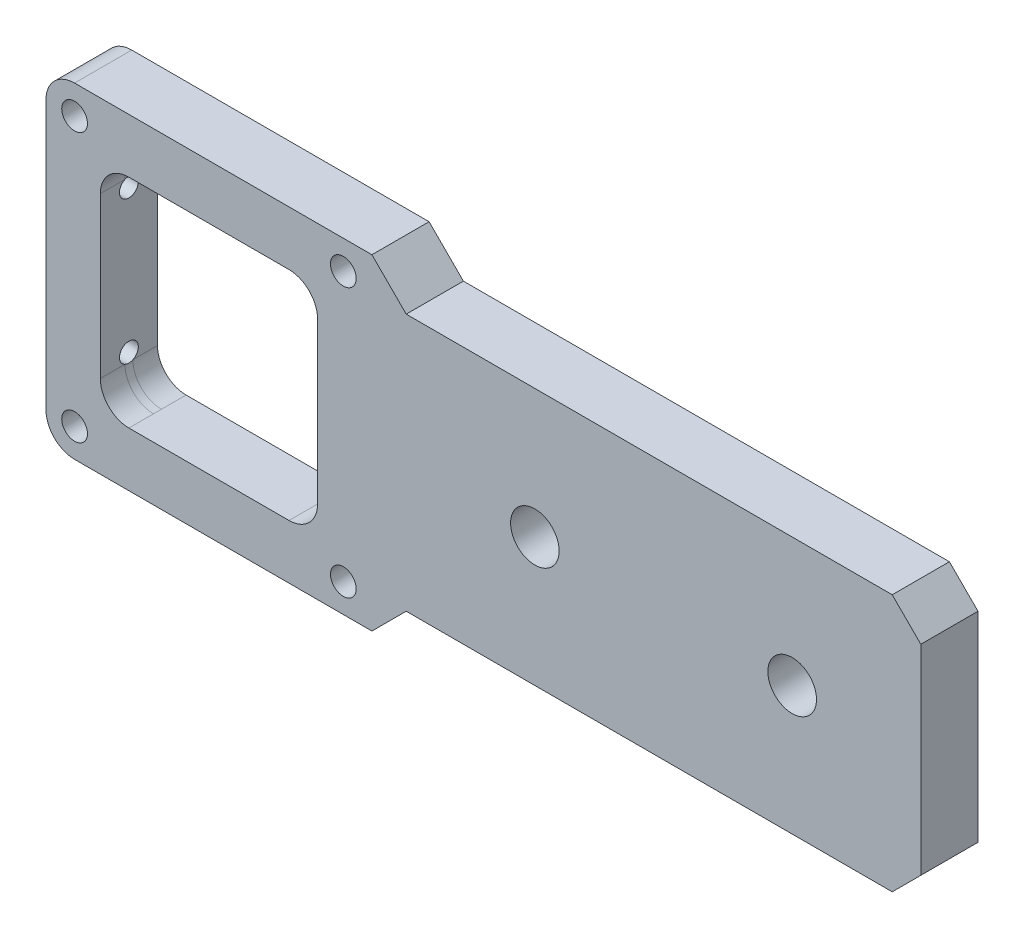
from build123d import *

# Parameters (mm, degrees)
EXTRUDE_1_DEPTH              = 5
SKETCH_6_R                   = 10
CUT_EXTRUDE_1526_DEPTH       = 10
SKETCH_19_R                  = 12
CUT_EXTRUDE_1942_DEPTH       = 5
HOLE_WIZARD_8_5_8_5_1_D      = 8.5
HOLE_WIZARD_1_D              = 4.5
HOLE_WIZARD_1_CBORE_D        = 8
HOLE_WIZARD_1_CBORE_DEPTH    = 4.6
FILLET_1_R                   = 5
CHAMFER_1_SIZE               = 5
CHAMFER_2_SIZE               = 0.2
HOLE_WIZARD_M4_1_D           = 3.3
HOLE_WIZARD_M4_1_DEPTH       = 15.5
HOLE_WIZARD_M4_1_CSINK_D     = 4.05
HOLE_WIZARD_M4_1_CSINK_ANGLE = 120
SKETCH_22_W                  = 38
SKETCH_22_H                  = 38
CUT_EXTRUDE_1_DEPTH          = 10
FILLET_2_R                   = 5


with BuildPart() as part:
    # 草图1 → 凸台-拉伸1 (new, symmetric)
    with BuildSketch(Plane.XY):
        Polygon((28.5, -28.5), (34.5, -22.5), (124.5, -22.5), (124.5, 22.5), (34.5, 22.5), (28.5, 28.5), (-28.5, 28.5), (-28.5, -28.5), align=None)
    extrude(amount=EXTRUDE_1_DEPTH, both=True)

    # 草图6 → Cut-Extrude 1526 (cut)
    with BuildSketch(Plane.XY.offset(5)):
        Circle(SKETCH_6_R)
    extrude(amount=-CUT_EXTRUDE_1526_DEPTH, mode=Mode.SUBTRACT)

    # 草图19 → Cut-Extrude 1942 (cut)
    with BuildSketch(Plane(origin=(0, 0, -5), x_dir=(-1, 0, 0), z_dir=(0, 0, -1))):
        Circle(SKETCH_19_R)
    extrude(amount=-CUT_EXTRUDE_1942_DEPTH, mode=Mode.SUBTRACT)

    # Ø8.5 (8.5) 直径孔1 (through all)
    with Locations(Plane.XY.offset(5)):
        with Locations((57, 0), (102, 0)):
            Hole(HOLE_WIZARD_8_5_8_5_1_D / 2)

    # 打孔尺寸(%根据)内六角圆柱头螺钉的类型1 (through all)
    with Locations(Plane(origin=(0, 0, -5), x_dir=(-1, 0, 0), z_dir=(0, 0, -1))):
        with Locations((-23.5, 23.5), (23.5, 23.5), (23.5, -23.5), (-23.5, -23.5)):
            CounterBoreHole(HOLE_WIZARD_1_D / 2, HOLE_WIZARD_1_CBORE_D / 2, HOLE_WIZARD_1_CBORE_DEPTH)

    # 圆角1
    fillet_1_edges = [part.edges().sort_by_distance(p)[0] for p in [
        (-28.5, 28.5, 0),
        (-28.5, -28.5, 0),
    ]]
    fillet(fillet_1_edges, radius=FILLET_1_R)

    # 倒角1
    chamfer_1_edges = [part.edges().sort_by_distance(p)[0] for p in [
        (124.5, 22.5, 0),
        (124.5, -22.5, 0),
    ]]
    chamfer(chamfer_1_edges, length=CHAMFER_1_SIZE)

    # 倒角2
    chamfer_2_edges = [part.edges().sort_by_distance(p)[0] for p in [
        (12, 0, -5),
    ]]
    chamfer(chamfer_2_edges, length=CHAMFER_2_SIZE)

    # M4 螺纹孔1
    with Locations(Plane.ZY.offset(28.5)):
        with Locations((0, 12.5), (0, -12.5)):
            CounterSinkHole(HOLE_WIZARD_M4_1_D / 2, HOLE_WIZARD_M4_1_CSINK_D / 2, depth=HOLE_WIZARD_M4_1_DEPTH, counter_sink_angle=HOLE_WIZARD_M4_1_CSINK_ANGLE)

    # 草图22 → 切除-拉伸1 (cut)
    with BuildSketch(Plane(origin=(0, 0, -5), x_dir=(-1, 0, 0), z_dir=(0, 0, -1))):
        Rectangle(SKETCH_22_W, SKETCH_22_H)
    extrude(amount=-CUT_EXTRUDE_1_DEPTH, mode=Mode.SUBTRACT)

    # 圆角2
    fillet_2_edges = [part.edges().sort_by_distance(p)[0] for p in [
        (19, -19, 0),
        (-19, -19, 0),
        (-19, 19, 0),
        (19, 19, 0),
    ]]
    fillet(fillet_2_edges, radius=FILLET_2_R)


solid = part.part
